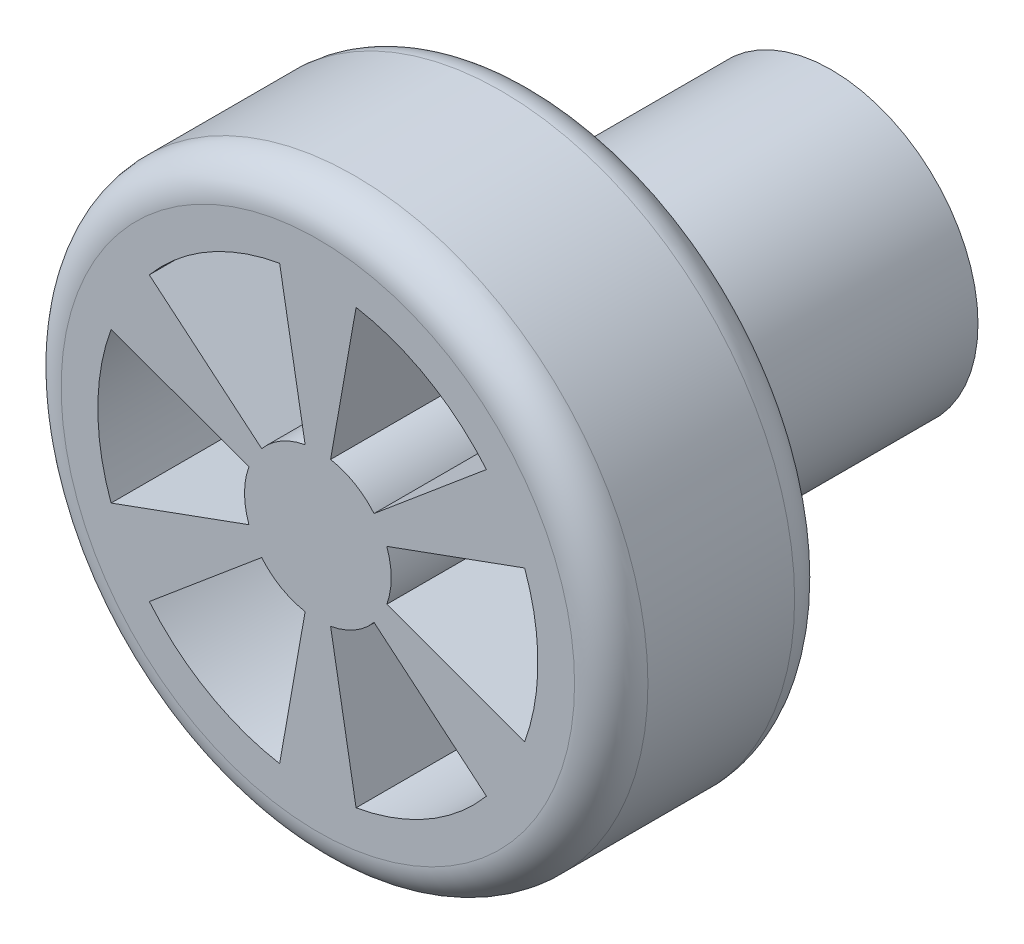
from build123d import *

# Parameters (mm, degrees)
SKETCH1_R           = 101.6
BOSS_EXTRUDE2_DEPTH = 76.2
CUT_EXTRUDE1_REACH  = 164.639
FILLET1_R           = 12.7
SKETCH6_R           = 50.8
BOSS_EXTRUDE4_DEPTH = 101.6


with BuildPart() as part:
    # Sketch1 → Boss-Extrude2 (new body)
    with BuildSketch(Plane.XY):
        Circle(SKETCH1_R)
    extrude(amount=BOSS_EXTRUDE2_DEPTH)

    # Sketch5 → Cut-Extrude1 (cut, up to next)
    with BuildSketch(Plane(origin=(0, 0, 0), x_dir=(-1, 0, 0), z_dir=(0, 0, -1)), mode=Mode.PRIVATE) as cut_extrude1_sk1:
        with BuildLine():
            Line((23.868192568, 8.68731164), (71.604577704, 26.061934921))
            ThreePointArc((71.604577704, 26.061934921), (76.2, 0), (71.604577704, -26.061934921))
            Line((71.604577704, -26.061934921), (23.868192568, -8.68731164))
            ThreePointArc((23.868192568, -8.68731164), (25.4, 0), (23.868192568, 8.68731164))
        make_face()
    cut_extrude1_tool1 = extrude(cut_extrude1_sk1.sketch, amount=-CUT_EXTRUDE1_REACH, mode=Mode.PRIVATE) & part.part
    # Sketch5 → Cut-Extrude1 (cut, up to next)
    with BuildSketch(Plane(origin=(0, 0, 0), x_dir=(-1, 0, 0), z_dir=(0, 0, -1)), mode=Mode.PRIVATE) as cut_extrude1_sk2:
        with BuildLine():
            Line((19.457528855, -16.326805286), (58.372586566, -48.980415858))
            ThreePointArc((58.372586566, -48.980415858), (38.1, -65.991135768), (13.231991138, -75.04235078))
            Line((13.231991138, -75.04235078), (4.410663713, -25.014116927))
            ThreePointArc((4.410663713, -25.014116927), (12.7, -21.997045256), (19.457528855, -16.326805286))
        make_face()
    cut_extrude1_tool2 = extrude(cut_extrude1_sk2.sketch, amount=-CUT_EXTRUDE1_REACH, mode=Mode.PRIVATE) & part.part
    # Sketch5 → Cut-Extrude1 (cut, up to next)
    with BuildSketch(Plane(origin=(0, 0, 0), x_dir=(-1, 0, 0), z_dir=(0, 0, -1)), mode=Mode.PRIVATE) as cut_extrude1_sk3:
        with BuildLine():
            Line((-4.410663713, -25.014116927), (-13.231991138, -75.04235078))
            ThreePointArc((-13.231991138, -75.04235078), (-38.1, -65.991135768), (-58.372586566, -48.980415858))
            Line((-58.372586566, -48.980415858), (-19.457528855, -16.326805286))
            ThreePointArc((-19.457528855, -16.326805286), (-12.7, -21.997045256), (-4.410663713, -25.014116927))
        make_face()
    cut_extrude1_tool3 = extrude(cut_extrude1_sk3.sketch, amount=-CUT_EXTRUDE1_REACH, mode=Mode.PRIVATE) & part.part
    # Sketch5 → Cut-Extrude1 (cut, up to next)
    with BuildSketch(Plane(origin=(0, 0, 0), x_dir=(-1, 0, 0), z_dir=(0, 0, -1)), mode=Mode.PRIVATE) as cut_extrude1_sk4:
        with BuildLine():
            Line((-23.868192568, -8.68731164), (-71.604577704, -26.061934921))
            ThreePointArc((-71.604577704, -26.061934921), (-76.2, 0), (-71.604577704, 26.061934921))
            Line((-71.604577704, 26.061934921), (-23.868192568, 8.68731164))
            ThreePointArc((-23.868192568, 8.68731164), (-25.4, 0), (-23.868192568, -8.68731164))
        make_face()
    cut_extrude1_tool4 = extrude(cut_extrude1_sk4.sketch, amount=-CUT_EXTRUDE1_REACH, mode=Mode.PRIVATE) & part.part
    # Sketch5 → Cut-Extrude1 (cut, up to next)
    with BuildSketch(Plane(origin=(0, 0, 0), x_dir=(-1, 0, 0), z_dir=(0, 0, -1)), mode=Mode.PRIVATE) as cut_extrude1_sk5:
        with BuildLine():
            Line((-19.457528855, 16.326805286), (-58.372586566, 48.980415858))
            ThreePointArc((-58.372586566, 48.980415858), (-38.1, 65.991135768), (-13.231991138, 75.04235078))
            Line((-13.231991138, 75.04235078), (-4.410663713, 25.014116927))
            ThreePointArc((-4.410663713, 25.014116927), (-12.7, 21.997045256), (-19.457528855, 16.326805286))
        make_face()
    cut_extrude1_tool5 = extrude(cut_extrude1_sk5.sketch, amount=-CUT_EXTRUDE1_REACH, mode=Mode.PRIVATE) & part.part
    # Sketch5 → Cut-Extrude1 (cut, up to next)
    with BuildSketch(Plane(origin=(0, 0, 0), x_dir=(-1, 0, 0), z_dir=(0, 0, -1)), mode=Mode.PRIVATE) as cut_extrude1_sk6:
        with BuildLine():
            Line((4.410663713, 25.014116927), (13.231991138, 75.04235078))
            ThreePointArc((13.231991138, 75.04235078), (38.1, 65.991135768), (58.372586566, 48.980415858))
            Line((58.372586566, 48.980415858), (19.457528855, 16.326805286))
            ThreePointArc((19.457528855, 16.326805286), (12.7, 21.997045256), (4.410663713, 25.014116927))
        make_face()
    cut_extrude1_tool6 = extrude(cut_extrude1_sk6.sketch, amount=-CUT_EXTRUDE1_REACH, mode=Mode.PRIVATE) & part.part
    add(cut_extrude1_tool1.solids().sort_by_distance((-53.922515, 0, 0))[0], mode=Mode.SUBTRACT)
    add(cut_extrude1_tool2.solids().sort_by_distance((-26.961258, -46.698268, 0))[0], mode=Mode.SUBTRACT)
    add(cut_extrude1_tool3.solids().sort_by_distance((26.961258, -46.698268, 0))[0], mode=Mode.SUBTRACT)
    add(cut_extrude1_tool4.solids().sort_by_distance((53.922515, 0, 0))[0], mode=Mode.SUBTRACT)
    add(cut_extrude1_tool5.solids().sort_by_distance((26.961258, 46.698268, 0))[0], mode=Mode.SUBTRACT)
    add(cut_extrude1_tool6.solids().sort_by_distance((-26.961258, 46.698268, 0))[0], mode=Mode.SUBTRACT)

    # Fillet1
    fillet1_edges = [part.edges().sort_by_distance(p)[0] for p in [
        (-101.6, 0, 0),
        (-101.6, 0, 76.2),
    ]]
    fillet(fillet1_edges, radius=FILLET1_R)


with BuildPart() as body_2:
    # Sketch6 → Boss-Extrude4 (new body)
    with BuildSketch(Plane(origin=(0, 0, 0), x_dir=(-1, 0, 0), z_dir=(0, 0, -1))):
        Circle(SKETCH6_R)
    extrude(amount=BOSS_EXTRUDE4_DEPTH)


solid = Compound([part.part, body_2.part])
